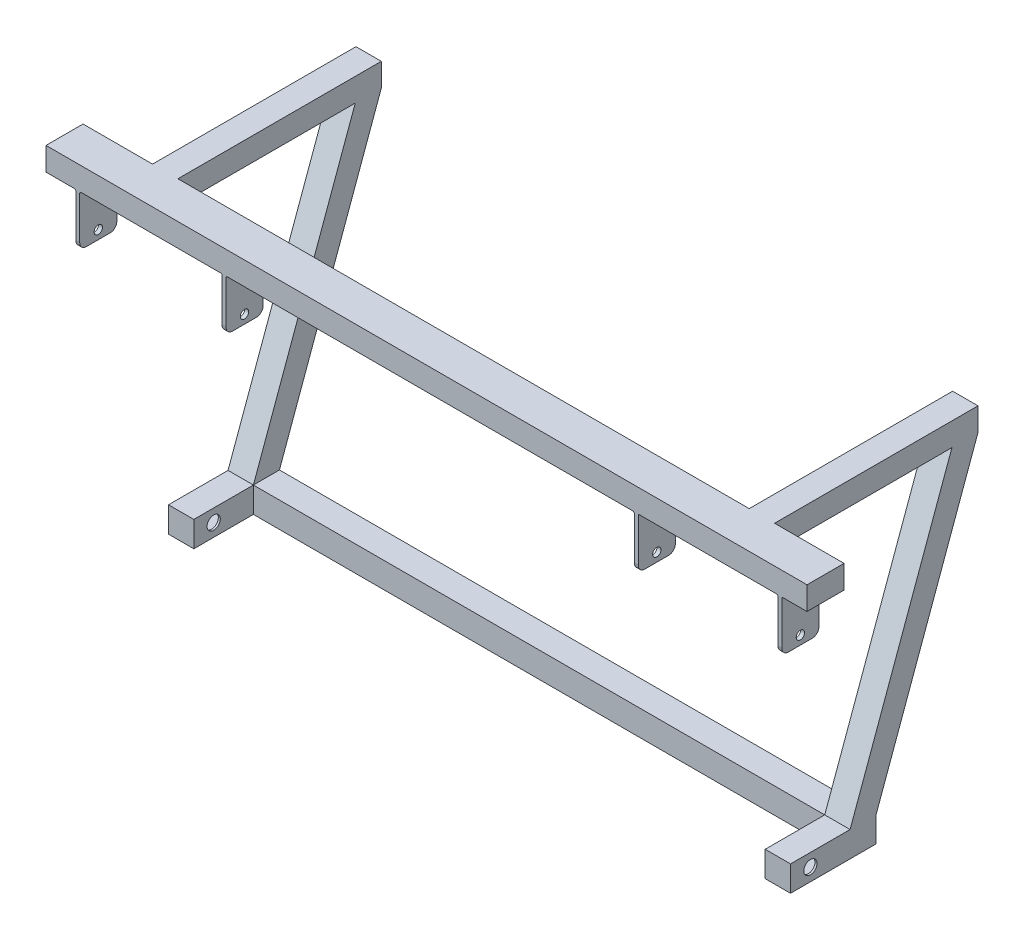
from build123d import *

# Parameters (mm, degrees)
SKETCH1_W            = 1150
SKETCH1_H            = 35
BOSS_EXTRUDE1_DEPTH  = 28
SKETCH4_W            = 38.3
SKETCH4_H            = 35
BOSS_EXTRUDE4_DEPTH  = 307.4
BOSS_EXTRUDE5_DEPTH  = 38.3
BOSS_EXTRUDE6_DEPTH  = 38.3
SKETCH7_W            = 38.3
SKETCH7_H            = 39.4
BOSS_EXTRUDE7_DEPTH  = 38.5
SKETCH8_W            = 39.4
SKETCH8_H            = 38.5
BOSS_EXTRUDE8_DEPTH  = 901.7
SKETCH9_W            = 38.3
SKETCH9_H            = 38.5
BOSS_EXTRUDE9_DEPTH  = 90
SKETCH11_W           = 6
SKETCH11_H           = 56
BOSS_EXTRUDE10_DEPTH = 77
FILLET1_R            = 10
CUT_EXTRUDE1_REACH   = 1252.131
SKETCH12_R           = 6.3
SHELL1_START         = -467
SHELL1_OUTLINE_W     = 32.5
SHELL1_OUTLINE_H     = 33.4
SHELL1_OUTLINE_W_2   = 29
SHELL1_OUTLINE_H_2   = 50
SHELL1_DEPTH         = 934
SHELL1_2_DEPTH       = 32.3
SHELL1_START_2       = 434.7
SHELL1_3_DEPTH       = 32.3
SHELL1_START_3       = -572
SHELL1_4_OUTLINE_W   = 29
SHELL1_4_OUTLINE_H   = 50
SHELL1_4_DEPTH       = 1147
BOSS_EXTRUDE12_REACH = 830.567
SKETCH17_W           = 3
SKETCH17_H           = 50
FILLET2_R            = 2
CUT_EXTRUDE2_START   = -940
SKETCH18_R           = 10
CUT_EXTRUDE2_DEPTH   = 940


# Read off the part's stored shape, not the designer's step: Shell1
with BuildPart() as part:
    # Sketch1 → Boss-Extrude1 (new, symmetric)
    with BuildSketch(Plane.XY):
        Rectangle(SKETCH1_W, SKETCH1_H)
    extrude(amount=BOSS_EXTRUDE1_DEPTH, both=True)

    # Sketch4 → Boss-Extrude4 (add)
    with BuildSketch(Plane(origin=(0, 0, -28), x_dir=(-1, 0, 0), z_dir=(0, 0, -1))):
        with Locations((-450.85, 0)):
            Rectangle(SKETCH4_W, SKETCH4_H)
        with Locations((450.85, 0)):
            Rectangle(SKETCH4_W, SKETCH4_H)
    extrude(amount=BOSS_EXTRUDE4_DEPTH)

    # Sketch5 → Boss-Extrude5 (add)
    with BuildSketch(Plane(origin=(470, 0, 0), x_dir=(0, 0, -1), z_dir=(1, 0, 0))):
        Polygon((335.4, -17.5), (296, -17.5), (142.090935503, -440.361679354), (181.490935503, -440.361679354), align=None)
    extrude(amount=-BOSS_EXTRUDE5_DEPTH)

    # Sketch6 → Boss-Extrude6 (add)
    with BuildSketch(Plane(origin=(-431.7, 0, 0), x_dir=(0, 0, -1), z_dir=(1, 0, 0))):
        Polygon((335.4, -17.5), (296, -17.5), (142.090935503, -440.361679354), (181.490935503, -440.361679354), align=None)
    extrude(amount=-BOSS_EXTRUDE6_DEPTH)

    # Sketch7 → Boss-Extrude7 (add)
    with BuildSketch(Plane.XZ.offset(440.361679354)):
        with Locations((450.85, -161.790935503)):
            Rectangle(SKETCH7_W, SKETCH7_H)
    extrude(amount=BOSS_EXTRUDE7_DEPTH)

    # Sketch8 → Boss-Extrude8 (add)
    with BuildSketch(Plane.ZY.offset(-431.7)):
        with Locations((-161.790935503, -459.611679354)):
            Rectangle(SKETCH8_W, SKETCH8_H)
    extrude(amount=BOSS_EXTRUDE8_DEPTH)

    # Sketch9 → Boss-Extrude9 (add)
    with BuildSketch(Plane.XY.offset(-142.090935503)):
        with Locations((-450.85, -459.611679354)):
            Rectangle(SKETCH9_W, SKETCH9_H)
        with Locations((450.85, -459.611679354)):
            Rectangle(SKETCH9_W, SKETCH9_H)
    extrude(amount=BOSS_EXTRUDE9_DEPTH)

    # Sketch11 → Boss-Extrude10 (add)
    with BuildSketch(Plane.XZ.offset(17.5)):
        with Locations((-527, 0)):
            Rectangle(SKETCH11_W, SKETCH11_H)
        with Locations((-306, 0)):
            Rectangle(SKETCH11_W, SKETCH11_H)
        with Locations((317, 0)):
            Rectangle(SKETCH11_W, SKETCH11_H)
        with Locations((534, 0)):
            Rectangle(SKETCH11_W, SKETCH11_H)
    extrude(amount=BOSS_EXTRUDE10_DEPTH)

    # Fillet1
    fillet1_edges = [part.edges().sort_by_distance(p)[0] for p in [
        (-527, -94.5, 28),
        (-527, -94.5, -28),
        (-306, -94.5, 28),
        (-306, -94.5, -28),
        (534, -94.5, 28),
        (534, -94.5, -28),
        (317, -94.5, 28),
        (317, -94.5, -28),
    ]]
    fillet(fillet1_edges, radius=FILLET1_R)

    # Cut-Extrude1: up to this face of the body (flat: up to its plane)
    cut_extrude1_end = Plane(part.part.faces().sort_by_distance((537, -55.635386562, 0))[0])
    # Sketch12 → Cut-Extrude1 (cut, up to the picked face)
    with BuildSketch(Plane.ZY.offset(530), mode=Mode.PRIVATE) as cut_extrude1_sk1:
        with Locations(Location((0, -81.3, 0), (0, 0, 180))):
            Circle(SKETCH12_R)
    cut_extrude1_tool1 = split(extrude(cut_extrude1_sk1.sketch, amount=-CUT_EXTRUDE1_REACH, mode=Mode.PRIVATE), bisect_by=cut_extrude1_end, keep=Keep.BOTH, mode=Mode.PRIVATE)
    add(cut_extrude1_tool1.solids().sort_by(Axis((-530, -81.3, 0), (1, 0, 0)))[0], mode=Mode.SUBTRACT)

    # Shell1 outline → Shell1 (cut)
    with BuildSketch(Plane.YZ.offset(SHELL1_START)):
        with Locations((-459.611679354, -161.790935503)):
            Rectangle(SHELL1_OUTLINE_W, SHELL1_OUTLINE_H)
        Rectangle(SHELL1_OUTLINE_W_2, SHELL1_OUTLINE_H_2)
    extrude(amount=SHELL1_DEPTH, mode=Mode.SUBTRACT)

    # Shell1 2 outline → Shell1 2 (cut)
    with BuildSketch(Plane.YZ.offset(SHELL1_START)):
        Polygon((-475.861679354, -55.090935503), (-475.861679354, -145.090935503), (-443.361679354, -145.090935503), (-443.361679354, -178.490935503), (-439.832698412, -178.490935503), (-16.971019058, -332.4), (14.5, -332.4), (14.5, -25), (-14.5, -25), (-14.5, -300.28444402), (-443.361679354, -144.191558118), (-443.361679354, -55.090935503), align=None)
    extrude(amount=SHELL1_2_DEPTH, mode=Mode.SUBTRACT)

    # Shell1 3 outline → Shell1 3 (cut)
    with BuildSketch(Plane.YZ.offset(SHELL1_START_2)):
        Polygon((-475.861679354, -55.090935503), (-475.861679354, -145.090935503), (-443.361679354, -145.090935503), (-443.361679354, -178.490935503), (-439.832698412, -178.490935503), (-16.971019058, -332.4), (14.5, -332.4), (14.5, -25), (-14.5, -25), (-14.5, -300.28444402), (-443.361679354, -144.191558118), (-443.361679354, -55.090935503), align=None)
    extrude(amount=SHELL1_3_DEPTH, mode=Mode.SUBTRACT)

    # Shell1 4 outline → Shell1 4 (cut)
    with BuildSketch(Plane.YZ.offset(SHELL1_START_3)):
        Rectangle(SHELL1_4_OUTLINE_W, SHELL1_4_OUTLINE_H)
    extrude(amount=SHELL1_4_DEPTH, mode=Mode.SUBTRACT)

    # Sketch17 → Boss-Extrude12 (add, up to next)
    with BuildSketch(Plane.XZ.offset(-14.5), mode=Mode.PRIVATE) as boss_extrude12_sk1:
        with Locations((573.5, 0)):
            Rectangle(SKETCH17_W, SKETCH17_H)
    boss_extrude12_tool1 = extrude(boss_extrude12_sk1.sketch, amount=BOSS_EXTRUDE12_REACH, mode=Mode.PRIVATE) - part.part
    add(boss_extrude12_tool1.solids().sort_by_distance((573.5, 14.5, 0))[0])

    # Fillet2
    fillet2_edges = [part.edges().sort_by_distance(p)[0] for p in [
        (-530, -17.5, 0),
        (-524, -17.5, 0),
        (-309, -17.5, 0),
        (-303, -17.5, 0),
        (531, -17.5, 0),
        (537, -17.5, 0),
        (314, -17.5, 0),
        (320, -17.5, 0),
    ]]
    fillet(fillet2_edges, radius=FILLET2_R)

    # Sketch18 → Cut-Extrude2 (cut)
    with BuildSketch(Plane(origin=(470, 0, 0), x_dir=(0, 0, -1), z_dir=(1, 0, 0)).offset(CUT_EXTRUDE2_START)):
        with Locations((82.090935503, -459.611679354)):
            Circle(SKETCH18_R)
    extrude(amount=CUT_EXTRUDE2_DEPTH, mode=Mode.SUBTRACT)


solid = part.part
